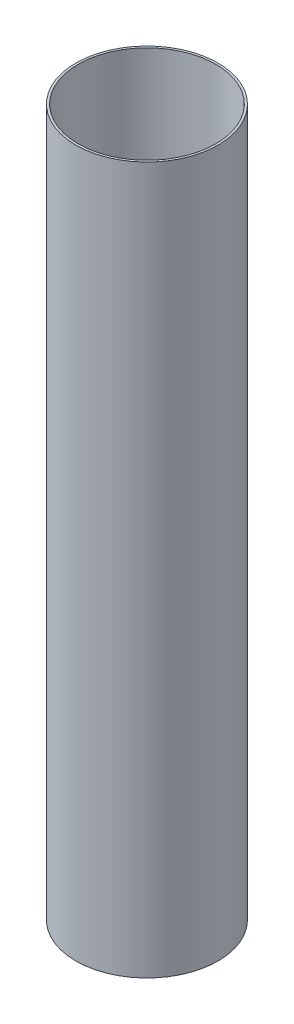
from build123d import *

# Parameters (mm, degrees)
SKETCH1_R           = 51.1048
SKETCH1_R_2         = 49.53
BOSS_EXTRUDE1_DEPTH = 508


with BuildPart() as part:
    # Sketch1 → Boss-Extrude1 (new body)
    with BuildSketch(Plane(origin=(0, 0, 0), x_dir=(1, 0, 0), z_dir=(0, 1, 0))):
        Circle(SKETCH1_R)
        Circle(SKETCH1_R_2, mode=Mode.SUBTRACT)
    extrude(amount=BOSS_EXTRUDE1_DEPTH)


solid = part.part
